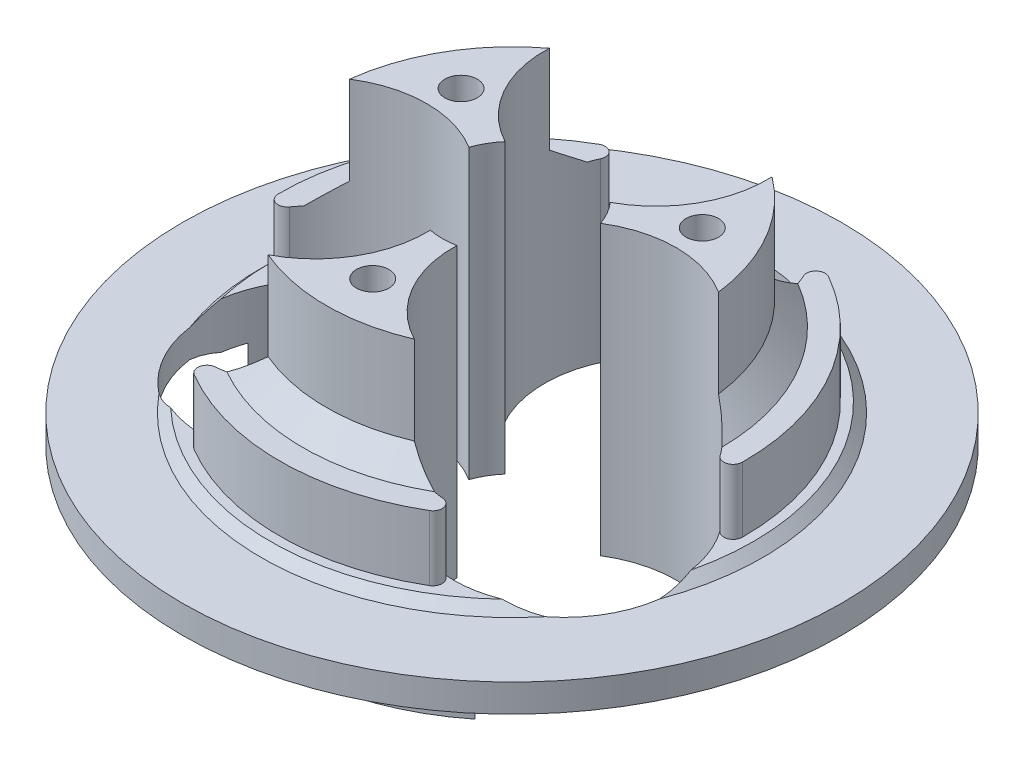
from build123d import *

# Parameters (mm, degrees)
SKETCH1_R           = 35.5
BOSS_EXTRUDE1_DEPTH = 1.5
SKETCH2_R           = 26
BOSS_EXTRUDE2_DEPTH = 1
SKETCH3_R           = 25
BOSS_EXTRUDE3_DEPTH = 19
SKETCH4_R           = 12
CUT_EXTRUDE1_DEPTH  = 56.222278113
SKETCH5_R           = 7.5
CUT_EXTRUDE2_DEPTH  = 56.222278113
FILLET1_R           = 1
SKETCH6_R           = 30.018937713
SKETCH6_R_2         = 20
CUT_EXTRUDE3_DEPTH  = 12
CHAMFER2_SIZE       = 2.5
BOSS_EXTRUDE4_START = 8
SKETCH8_R           = 25
BOSS_EXTRUDE4_DEPTH = 8
SKETCH10_R          = 7.5
CUT_EXTRUDE6_DEPTH  = 60.004237189
SKETCH7_R           = 1.75
CUT_EXTRUDE4_DEPTH  = 60.004237136
BOSS_EXTRUDE5_START = 1
SKETCH11_R          = 26
SKETCH11_R_2        = 25
BOSS_EXTRUDE5_DEPTH = 1
SKETCH9_R           = 12
CUT_EXTRUDE5_DEPTH  = 60.004237189
CHAMFER1_SIZE       = 1


with BuildPart() as part:
    # Sketch1 → Boss-Extrude1 (new, symmetric)
    with BuildSketch(Plane(origin=(0, 0, 0), x_dir=(1, 0, 0), z_dir=(0, 1, 0))):
        with Locations(Location((0, 0, 0), (0, 0, 270))):
            Circle(SKETCH1_R)
    extrude(amount=BOSS_EXTRUDE1_DEPTH, both=True)

    # Sketch2 → Boss-Extrude2 (add)
    with BuildSketch(Plane(origin=(0, 1.5, 0), x_dir=(1, 0, 0), z_dir=(0, 1, 0))):
        with Locations(Location((0, 0, 0), (0, 0, 270))):
            Circle(SKETCH2_R)
    extrude(amount=BOSS_EXTRUDE2_DEPTH)

    # Sketch3 → Boss-Extrude3 (add)
    with BuildSketch(Plane(origin=(0, 2.5, 0), x_dir=(1, 0, 0), z_dir=(0, 1, 0))):
        with Locations(Location((0, 0, 0), (0, 0, 270))):
            Circle(SKETCH3_R)
    extrude(amount=BOSS_EXTRUDE3_DEPTH)

    # Sketch4 → Cut-Extrude1 (cut, through all)
    with BuildSketch(Plane(origin=(0, 21.5, 0), x_dir=(1, 0, 0), z_dir=(0, 1, 0))):
        with Locations(Location((0, 15.5, 0), (0, 0, 270))):
            Circle(SKETCH4_R)
        with Locations(Location((13.423393759, -7.75, 0), (0, 0, 270))):
            Circle(SKETCH4_R)
        with Locations(Location((-13.423393759, -7.75, 0), (0, 0, 270))):
            Circle(SKETCH4_R)
    extrude(amount=-CUT_EXTRUDE1_DEPTH, mode=Mode.SUBTRACT)

    # Sketch5 → Cut-Extrude2 (cut, through all)
    with BuildSketch(Plane(origin=(0, 21.5, 0), x_dir=(1, 0, 0), z_dir=(0, 1, 0))):
        Circle(SKETCH5_R)
    extrude(amount=-CUT_EXTRUDE2_DEPTH, mode=Mode.SUBTRACT)

    # Fillet1
    fillet1_edges = [part.edges().sort_by_distance(p)[0] for p in [
        (-24.723095296, 12, 3.710600891),
        (-15.575022283, 12, 19.555528141),
        (15.575022283, 12, 19.555528141),
        (24.723095296, 12, 3.710600891),
        (9.148073013, 12, -23.266129032),
        (-9.148073013, 12, -23.266129032),
    ]]
    fillet(fillet1_edges, radius=FILLET1_R)

    # Sketch6 → Cut-Extrude3 (cut)
    with BuildSketch(Plane(origin=(0, 21.5, 0), x_dir=(1, 0, 0), z_dir=(0, 1, 0))):
        Circle(SKETCH6_R)
        Circle(SKETCH6_R_2, mode=Mode.SUBTRACT)
    extrude(amount=-CUT_EXTRUDE3_DEPTH, mode=Mode.SUBTRACT)

    # Chamfer2
    chamfer2_edges = [part.edges().sort_by_distance(p)[0] for p in [
        (17.320508076, 9.5, -10),
        (-17.320508076, 9.5, -10),
        (0, 9.5, 20),
    ]]
    chamfer(chamfer2_edges, length=CHAMFER2_SIZE)

    # Sketch8 → Boss-Extrude4 (add)
    with BuildSketch(Plane.XZ.offset(1.5).offset(BOSS_EXTRUDE4_START)):
        with Locations(Location((0, 0, 0), (0, 0, 51.464391847))):
            Circle(SKETCH8_R)
    extrude(amount=-BOSS_EXTRUDE4_DEPTH)

    # Sketch10 → Cut-Extrude6 (cut, through all)
    with BuildSketch(Plane.XZ.offset(9.5)):
        with Locations(Location((0, 0, 0), (0, 0, 79.011010973))):
            Circle(SKETCH10_R)
    extrude(amount=-CUT_EXTRUDE6_DEPTH, mode=Mode.SUBTRACT)

    # Sketch7 → Cut-Extrude4 (cut, through all)
    with BuildSketch(Plane(origin=(0, 21.5, 0), x_dir=(1, 0, 0), z_dir=(0, 1, 0))):
        with Locations(Location((0, -15, 0), (0, 0, 270))):
            Circle(SKETCH7_R)
        with Locations(Location((-12.990381057, 7.5, 0), (0, 0, 270))):
            Circle(SKETCH7_R)
        with Locations(Location((12.990381057, 7.5, 0), (0, 0, 270))):
            Circle(SKETCH7_R)
    extrude(amount=-CUT_EXTRUDE4_DEPTH, mode=Mode.SUBTRACT)

    # Sketch11 → Boss-Extrude5 (add)
    with BuildSketch(Plane.XZ.offset(1.5).offset(BOSS_EXTRUDE5_START)):
        with Locations(Location((0, 0, 0), (0, 0, 46.639268068))):
            Circle(SKETCH11_R)
        with Locations(Location((0, 0, 0), (0, 0, 270))):
            Circle(SKETCH11_R_2, mode=Mode.SUBTRACT)
    extrude(amount=-BOSS_EXTRUDE5_DEPTH)

    # Sketch9 → Cut-Extrude5 (cut, through all)
    with BuildSketch(Plane.XZ.offset(9.5)):
        with Locations((-13.423393759, 7.75)):
            Circle(SKETCH9_R)
        with Locations((13.423393759, 7.75)):
            Circle(SKETCH9_R)
        with Locations((0, -15.5)):
            Circle(SKETCH9_R)
    extrude(amount=-CUT_EXTRUDE5_DEPTH, mode=Mode.SUBTRACT)

    # Chamfer1
    chamfer1_2_edges = [part.edges().sort_by_distance(p)[0] for p in [
        (-22.516660498, 1.5, -13),
        (22.516660498, 1.5, -13),
        (0, 1.5, 26),
        (22.516660498, -1.5, -13),
        (0, -1.5, 26),
        (-22.516660498, -1.5, -13),
    ]]
    chamfer(chamfer1_2_edges, length=CHAMFER1_SIZE - 0.0001)  # a hair under: the kernel refuses the full size


solid = part.part
